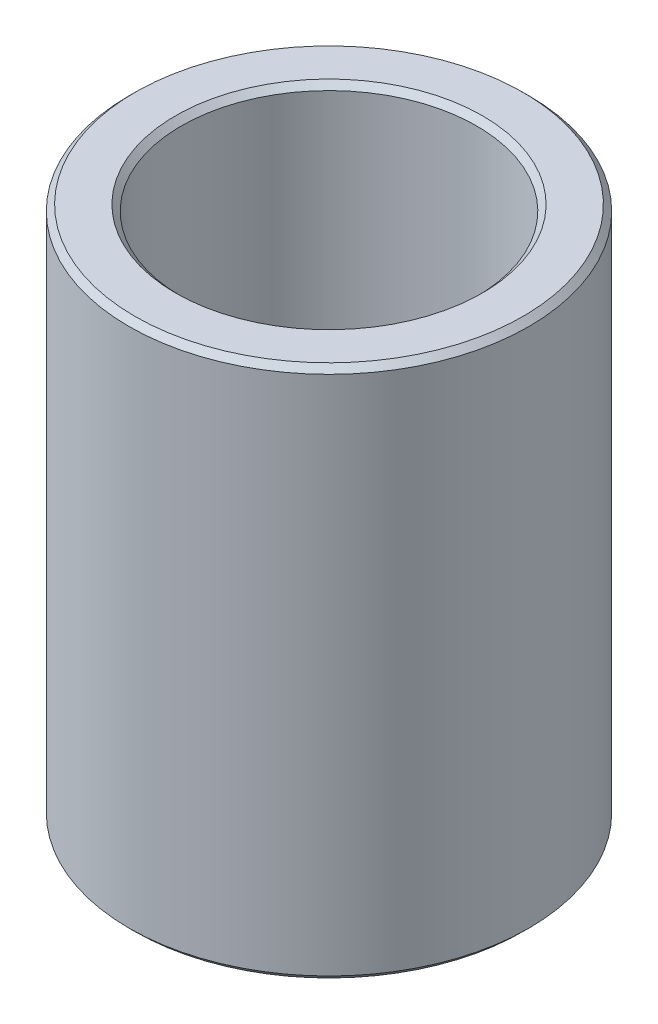
from build123d import *

# Parameters (mm, degrees)
SKETCH1_R           = 52.5
BOSS_EXTRUDE1_DEPTH = 139.917964699
SKETCH2_R           = 38.778410579
CUT_EXTRUDE1_DEPTH  = 159.396770313
CHAMFER1_SIZE       = 1.539163983


with BuildPart() as part:
    # Sketch1 → Boss-Extrude1 (new body)
    with BuildSketch(Plane(origin=(0, 0, 0), x_dir=(1, 0, 0), z_dir=(0, 1, 0))):
        Circle(SKETCH1_R)
    extrude(amount=BOSS_EXTRUDE1_DEPTH)

    # Sketch2 → Cut-Extrude1 (cut, through all)
    with BuildSketch(Plane(origin=(0, 0, 0), x_dir=(1, 0, 0), z_dir=(0, 1, 0))):
        Circle(SKETCH2_R)
    extrude(amount=CUT_EXTRUDE1_DEPTH, mode=Mode.SUBTRACT)

    # Chamfer1
    chamfer1_edges = [part.edges().sort_by_distance(p)[0] for p in [
        (-38.778410579, 139.917964699, 0),
        (-38.778410579, 0, 0),
        (-52.5, 0, 0),
        (-52.5, 139.917964699, 0),
    ]]
    chamfer(chamfer1_edges, length=CHAMFER1_SIZE)


solid = part.part
